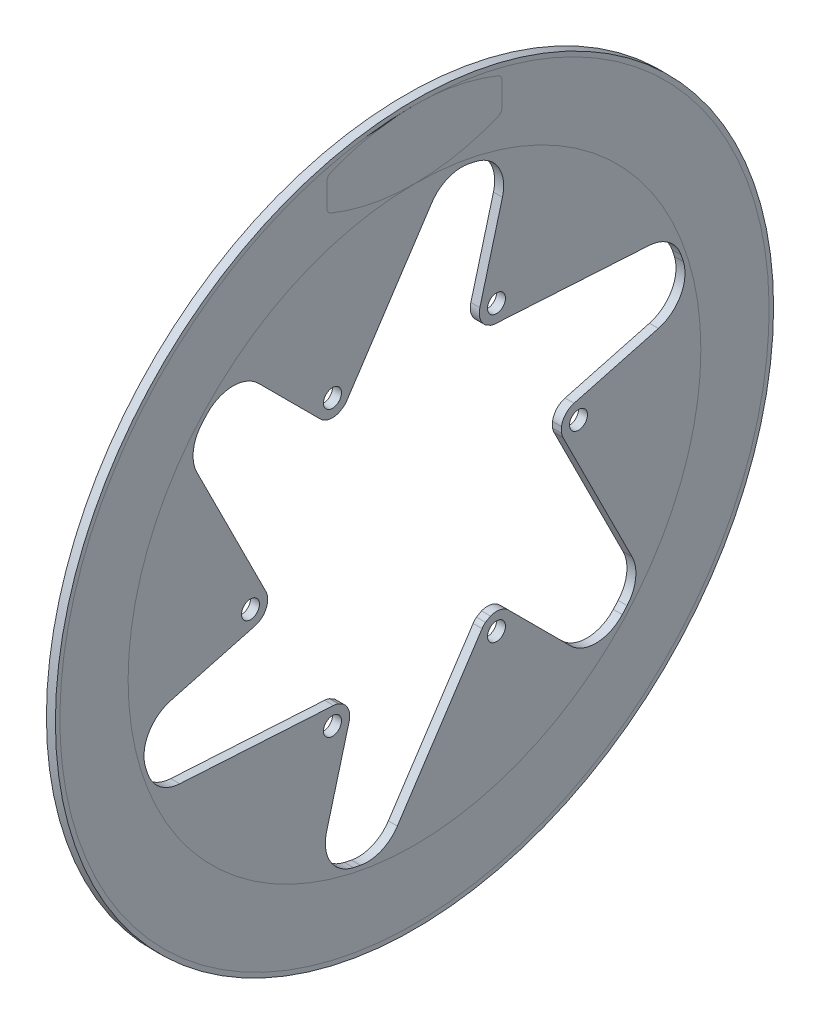
from build123d import *

# Parameters (mm, degrees)
SKETCH1_R           = 127
SKETCH1_R_2         = 3.175
BOSS_EXTRUDE1_DEPTH = 3.175


with BuildPart() as part:
    # Sketch1 → Boss-Extrude1 (new body)
    with BuildSketch(Plane(origin=(0, 0, 0), x_dir=(0, 0, -1), z_dir=(1, 0, 0))):
        Circle(SKETCH1_R)
        with Locations((-29, -50.229473419)):
            Circle(SKETCH1_R_2, mode=Mode.SUBTRACT)
        with Locations((29, -50.229473419)):
            Circle(SKETCH1_R_2, mode=Mode.SUBTRACT)
        with Locations((-58, 0)):
            Circle(SKETCH1_R_2, mode=Mode.SUBTRACT)
        with Locations((-29, 50.229473419)):
            Circle(SKETCH1_R_2, mode=Mode.SUBTRACT)
        with BuildLine():
            ThreePointArc((26.878591102, 44.514507078), (27.745916871, 44.263864355), (28.64074908, 44.144068357))
            Line((28.64074908, 44.144068357), (83.026985215, 40.933385559))
            ThreePointArc((83.026985215, 40.933385559), (89.959199105, 38.369684207), (94.290012338, 32.380342775))
            ThreePointArc((94.290012338, 32.380342775), (94.694849855, 31.176568699), (95.084319821, 29.967735135))
            ThreePointArc((95.084319821, 29.967735135), (94.105739886, 20.040980253), (86.258669488, 13.882931264))
            Line((86.258669488, 13.882931264), (56.422239101, 5.888283837))
            ThreePointArc((56.422239101, 5.888283837), (53.492460577, 4.104059497), (51.989989517, 1.020289173))
            ThreePointArc((51.989989517, 1.020289173), (51.997497319, 0.51016914), (52, 0))
            ThreePointArc((52, 0), (51.997497319, -0.51016914), (51.989989517, -1.020289173))
            ThreePointArc((51.989989517, -1.020289173), (52.206589437, -1.896736684), (52.550259164, -2.731582108))
            Line((52.550259164, -2.731582108), (76.962844364, -51.436785616))
            ThreePointArc((76.962844364, -51.436785616), (78.208720811, -58.722109626), (75.187205595, -65.467374621))
            ThreePointArc((75.187205595, -65.467374621), (74.347125424, -66.419861233), (73.494979832, -67.361568899))
            ThreePointArc((73.494979832, -67.361568899), (64.408867959, -71.477471256), (55.152305898, -67.760733441))
            Line((55.152305898, -67.760733441), (33.310522938, -45.918950481))
            ThreePointArc((33.310522938, -45.918950481), (30.300450072, -44.273800023), (26.878591102, -44.514507078))
            ThreePointArc((26.878591102, -44.514507078), (26, -45.033320997), (25.111398415, -45.534796251))
            ThreePointArc((25.111398415, -45.534796251), (24.460672566, -46.160601039), (23.909510083, -46.875650465))
            Line((23.909510083, -46.875650465), (-6.064140851, -92.370171175))
            ThreePointArc((-6.064140851, -92.370171175), (-11.750478295, -97.091793833), (-19.102806743, -97.847717396))
            ThreePointArc((-19.102806743, -97.847717396), (-20.347724431, -97.596429932), (-21.58933999, -97.329304034))
            ThreePointArc((-21.58933999, -97.329304034), (-29.696871927, -91.518451509), (-31.10636359, -81.643664705))
            Line((-31.10636359, -81.643664705), (-23.111716163, -51.807234318))
            ThreePointArc((-23.111716163, -51.807234318), (-23.192010506, -48.377859519), (-25.111398415, -45.534796251))
            ThreePointArc((-25.111398415, -45.534796251), (-26, -45.033320997), (-26.878591102, -44.514507078))
            ThreePointArc((-26.878591102, -44.514507078), (-27.745916871, -44.263864355), (-28.64074908, -44.144068357))
            Line((-28.64074908, -44.144068357), (-83.026985215, -40.933385559))
            ThreePointArc((-83.026985215, -40.933385559), (-89.959199105, -38.369684207), (-94.290012338, -32.380342775))
            ThreePointArc((-94.290012338, -32.380342775), (-94.694849855, -31.176568699), (-95.084319821, -29.967735135))
            ThreePointArc((-95.084319821, -29.967735135), (-94.105739886, -20.040980253), (-86.258669488, -13.882931264))
            Line((-86.258669488, -13.882931264), (-56.422239101, -5.888283837))
            ThreePointArc((-56.422239101, -5.888283837), (-53.492460577, -4.104059497), (-51.989989517, -1.020289173))
            ThreePointArc((-51.989989517, -1.020289173), (-52, 0), (-51.989989517, 1.020289173))
            ThreePointArc((-51.989989517, 1.020289173), (-52.206589437, 1.896736684), (-52.550259164, 2.731582108))
            Line((-52.550259164, 2.731582108), (-76.962844364, 51.436785616))
            ThreePointArc((-76.962844364, 51.436785616), (-78.208720811, 58.722109626), (-75.187205595, 65.467374621))
            ThreePointArc((-75.187205595, 65.467374621), (-74.347125424, 66.419861233), (-73.494979832, 67.361568899))
            ThreePointArc((-73.494979832, 67.361568899), (-64.408867959, 71.477471256), (-55.152305898, 67.760733441))
            Line((-55.152305898, 67.760733441), (-33.310522938, 45.918950481))
            ThreePointArc((-33.310522938, 45.918950481), (-30.300450072, 44.273800023), (-26.878591102, 44.514507078))
            ThreePointArc((-26.878591102, 44.514507078), (-26, 45.033320997), (-25.111398415, 45.534796251))
            ThreePointArc((-25.111398415, 45.534796251), (-24.460672566, 46.160601039), (-23.909510083, 46.875650465))
            Line((-23.909510083, 46.875650465), (6.064140851, 92.370171175))
            ThreePointArc((6.064140851, 92.370171175), (11.750478295, 97.091793833), (19.102806743, 97.847717396))
            ThreePointArc((19.102806743, 97.847717396), (20.347724431, 97.596429932), (21.58933999, 97.329304034))
            ThreePointArc((21.58933999, 97.329304034), (29.696871927, 91.518451509), (31.10636359, 81.643664705))
            Line((31.10636359, 81.643664705), (23.111716163, 51.807234318))
            ThreePointArc((23.111716163, 51.807234318), (23.192010506, 48.377859519), (25.111398415, 45.534796251))
            ThreePointArc((25.111398415, 45.534796251), (26, 45.033320997), (26.878591102, 44.514507078))
        make_face(mode=Mode.SUBTRACT)
        with Locations((58, 0)):
            Circle(SKETCH1_R_2, mode=Mode.SUBTRACT)
        with Locations((29, 50.229473419)):
            Circle(SKETCH1_R_2, mode=Mode.SUBTRACT)
    extrude(amount=BOSS_EXTRUDE1_DEPTH)


solid = part.part
